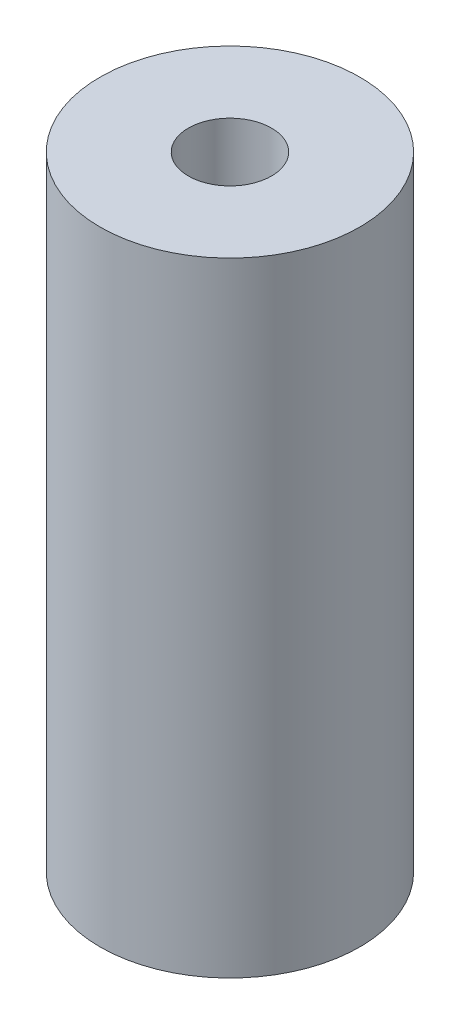
from build123d import *

# Parameters (mm, degrees)
SKETCH1_R                           = 2.5
BOSS_EXTRUDE1_DEPTH                 = 6
M2X0_4_TAPPED_HOLE1_D               = 1.6
M2X0_4_TAPPED_HOLE1_DEPTH           = 5.2
M2X0_4_TAPPED_HOLE1_TIP             = 0.480688495
M2X0_4_TAPPED_HOLE1_ON_FACE_2_D     = 1.6
M2X0_4_TAPPED_HOLE1_ON_FACE_2_DEPTH = 5.2
M2X0_4_TAPPED_HOLE1_ON_FACE_2_TIP   = 0.480688495


with BuildPart() as part:
    # Sketch1 → Boss-Extrude1 (new, symmetric)
    with BuildSketch(Plane(origin=(0, 0, 0), x_dir=(1, 0, 0), z_dir=(0, 1, 0))):
        Circle(SKETCH1_R)
    extrude(amount=BOSS_EXTRUDE1_DEPTH, both=True)

    # M2x0.4 Tapped Hole1
    with Locations(Plane.ZX.offset(6)):
        with Locations((0, 0)):
            Hole(M2X0_4_TAPPED_HOLE1_D / 2, depth=M2X0_4_TAPPED_HOLE1_DEPTH)
            with Locations((0, 0, -(M2X0_4_TAPPED_HOLE1_DEPTH + M2X0_4_TAPPED_HOLE1_TIP / 2))):  # 118° drill point
                Cone(0, M2X0_4_TAPPED_HOLE1_D / 2, M2X0_4_TAPPED_HOLE1_TIP, mode=Mode.SUBTRACT)

    # M2x0.4 Tapped Hole1 on face 2
    with Locations(Plane(origin=(0, -6, 0), x_dir=(0, 0, -1), z_dir=(0, -1, 0))):
        with Locations((0, 0)):
            Hole(M2X0_4_TAPPED_HOLE1_ON_FACE_2_D / 2, depth=M2X0_4_TAPPED_HOLE1_ON_FACE_2_DEPTH)
            with Locations((0, 0, -(M2X0_4_TAPPED_HOLE1_ON_FACE_2_DEPTH + M2X0_4_TAPPED_HOLE1_ON_FACE_2_TIP / 2))):  # 118° drill point
                Cone(0, M2X0_4_TAPPED_HOLE1_ON_FACE_2_D / 2, M2X0_4_TAPPED_HOLE1_ON_FACE_2_TIP, mode=Mode.SUBTRACT)


solid = part.part
